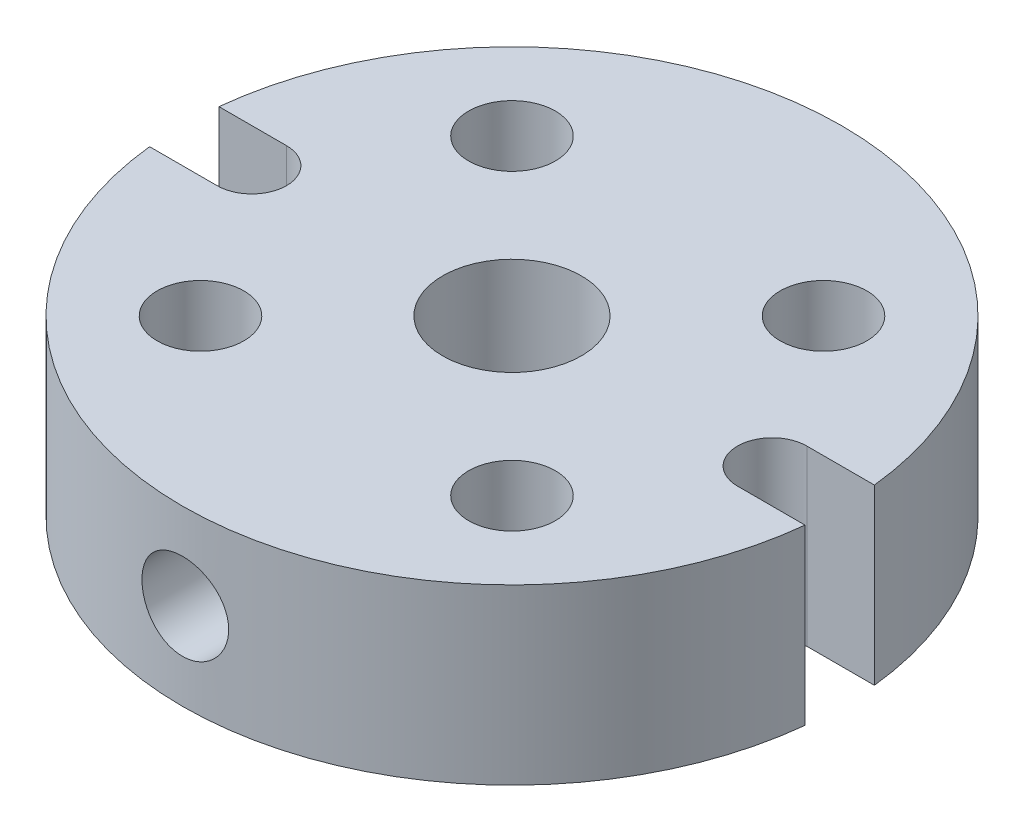
from build123d import *

# Parameters (mm, degrees)
SKETCH1_R               = 9.5
SKETCH1_R_2             = 2
SKETCH1_R_3             = 1.25
BASE_SHAPE_DEPTH        = 5
GRUB_SCREW_CUT_REACH    = 23.823
SKETCH3_R               = 1.25
MOTOR_SCREW_SLOTS_REACH = 16.335


with BuildPart() as part:
    # Sketch1 → Base shape (new body)
    with BuildSketch(Plane(origin=(0, 0, 0), x_dir=(1, 0, 0), z_dir=(0, 1, 0))):
        Circle(SKETCH1_R)
        Circle(SKETCH1_R_2, mode=Mode.SUBTRACT)
        with Locations((4.490128061, 4.490128061)):
            Circle(SKETCH1_R_3, mode=Mode.SUBTRACT)
        with Locations((-4.490128061, 4.490128061)):
            Circle(SKETCH1_R_3, mode=Mode.SUBTRACT)
        with Locations((4.490128061, -4.490128061)):
            Circle(SKETCH1_R_3, mode=Mode.SUBTRACT)
        with Locations((-4.490128061, -4.490128061)):
            Circle(SKETCH1_R_3, mode=Mode.SUBTRACT)
    extrude(amount=BASE_SHAPE_DEPTH)

    # Sketch3 → Grub screw cut (cut, up to next)
    with BuildSketch(Plane.XY.offset(9.5), mode=Mode.PRIVATE) as grub_screw_cut_sk1:
        with Locations((0, 2.5)):
            Circle(SKETCH3_R)
    grub_screw_cut_tool1 = extrude(grub_screw_cut_sk1.sketch, amount=-GRUB_SCREW_CUT_REACH, mode=Mode.PRIVATE) & part.part
    add(grub_screw_cut_tool1.solids().sort_by_distance((0, 2.5, 9.5))[0], mode=Mode.SUBTRACT)

    # Sketch4 → Motor screw slots (cut, up to next)
    with BuildSketch(Plane(origin=(0, 5, 0), x_dir=(1, 0, 0), z_dir=(0, 1, 0)), mode=Mode.PRIVATE) as motor_screw_slots_sk1:
        with BuildLine():
            Line((-9.447221814, 1), (-7.5, 1))
            ThreePointArc((-7.5, 1), (-6.5, 0), (-7.5, -1))
            Line((-7.5, -1), (-9.447221814, -1))
            ThreePointArc((-9.447221814, -1), (-10.447221814, 0), (-9.447221814, 1))
        make_face()
    motor_screw_slots_tool1 = extrude(motor_screw_slots_sk1.sketch, amount=-MOTOR_SCREW_SLOTS_REACH, mode=Mode.PRIVATE) & part.part
    # Sketch4 → Motor screw slots (cut, up to next)
    with BuildSketch(Plane(origin=(0, 5, 0), x_dir=(1, 0, 0), z_dir=(0, 1, 0)), mode=Mode.PRIVATE) as motor_screw_slots_sk2:
        with BuildLine():
            Line((9.447221814, 1), (7.5, 1))
            ThreePointArc((7.5, 1), (6.5, 0), (7.5, -1))
            Line((7.5, -1), (9.447221814, -1))
            ThreePointArc((9.447221814, -1), (10.447221814, 0), (9.447221814, 1))
        make_face()
    motor_screw_slots_tool2 = extrude(motor_screw_slots_sk2.sketch, amount=-MOTOR_SCREW_SLOTS_REACH, mode=Mode.PRIVATE) & part.part
    add(motor_screw_slots_tool1.solids().sort_by_distance((-8.473611, 5, 0))[0], mode=Mode.SUBTRACT)
    add(motor_screw_slots_tool2.solids().sort_by_distance((8.473611, 5, 0))[0], mode=Mode.SUBTRACT)


solid = part.part
